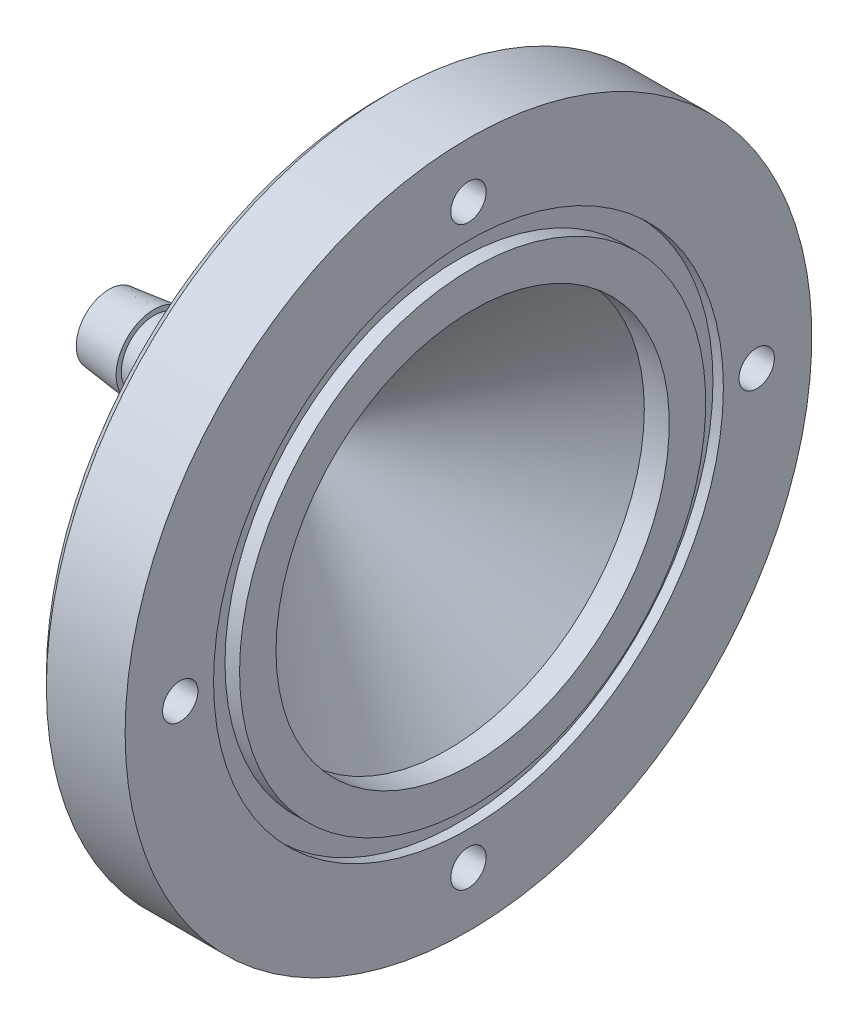
from build123d import *

# Parameters (mm, degrees)
CBORE_FOR_M3_HEX_SOCKET_HEAD_CAP_SCREW2_D           = 3.4
CBORE_FOR_M3_HEX_SOCKET_HEAD_CAP_SCREW2_DEPTH       = 8.566
CBORE_FOR_M3_HEX_SOCKET_HEAD_CAP_SCREW2_CBORE_D     = 6.5
CBORE_FOR_M3_HEX_SOCKET_HEAD_CAP_SCREW2_CBORE_DEPTH = 3.4
CBORE_FOR_M3_HEX_SOCKET_HEAD_CAP_SCREW2_TIP         = 1.021463052
CHAMFER1_SIZE                                       = 1


with BuildPart() as part:
    # Sketch1 → Revolve17 (revolve)
    with BuildSketch(Plane.XY):
        Polygon((-13.743115187, 3.15), (-13.743115187, 3.65), (-18.076448521, 3.15), (-18.076448521, 1.9), (0, 1.9), (14.469928658, 18.9), (16.869928658, 18.9), (16.869928658, 22.4), (15.469928658, 22.4), (15.469928658, 24.5), (16.469928658, 24.5), (16.469928658, 33), (7.903928658, 33), (7.903928658, 18.9), (-5.076448521, 3.65), (-9.409781854, 3.15), (-9.409781854, 3.65), align=None)
    revolve(axis=Axis((-801.920554309, 0, 0), (1, 0, 0)))

    # CBORE for M3 Hex Socket Head Cap Screw2
    with Locations(Plane.ZY.offset(-7.903928658)):
        with Locations((0, -27.7), (0, 27.7), (27.7, 0), (-27.7, 0)):
            CounterBoreHole(CBORE_FOR_M3_HEX_SOCKET_HEAD_CAP_SCREW2_D / 2, CBORE_FOR_M3_HEX_SOCKET_HEAD_CAP_SCREW2_CBORE_D / 2, CBORE_FOR_M3_HEX_SOCKET_HEAD_CAP_SCREW2_CBORE_DEPTH, depth=CBORE_FOR_M3_HEX_SOCKET_HEAD_CAP_SCREW2_DEPTH)
            with Locations((0, 0, -(CBORE_FOR_M3_HEX_SOCKET_HEAD_CAP_SCREW2_DEPTH + CBORE_FOR_M3_HEX_SOCKET_HEAD_CAP_SCREW2_TIP / 2))):  # 118° drill point
                Cone(0, CBORE_FOR_M3_HEX_SOCKET_HEAD_CAP_SCREW2_D / 2, CBORE_FOR_M3_HEX_SOCKET_HEAD_CAP_SCREW2_TIP, mode=Mode.SUBTRACT)

    # Chamfer1
    chamfer1_edges = [part.edges().sort_by_distance(p)[0] for p in [
        (7.903928658, -33, 0),
    ]]
    chamfer(chamfer1_edges, length=CHAMFER1_SIZE)


solid = part.part
